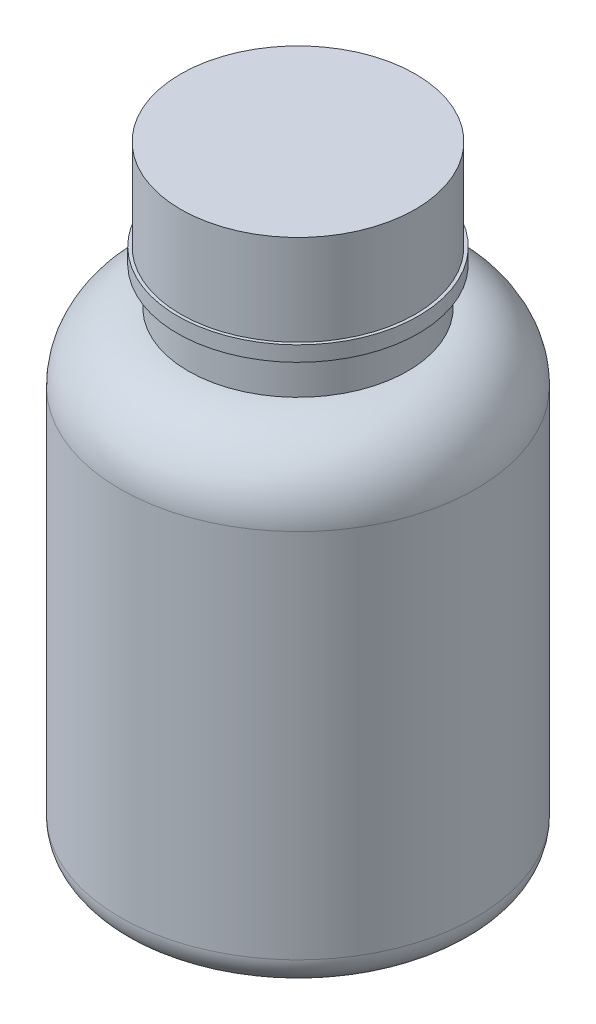
from build123d import *


with BuildPart() as part:
    # 草图1 → 旋转1 (revolve)
    with BuildSketch(Plane.XY):
        with BuildLine():
            Line((0, 56), (0, -25))
            Line((0, -25), (19.5, -25))
            ThreePointArc((19.5, -25), (22.328427125, -23.828427125), (23.5, -21))
            Line((23.5, -21), (23.5, 25))
            Line((23.5, 25), (23.5, 28))
            ThreePointArc((23.5, 28), (20.863961031, 34.363961031), (14.5, 37))
            Line((14.5, 37), (14.5, 42))
            Line((14.5, 42), (15.90903206, 42))
            Line((15.90903206, 42), (15.90903206, 44))
            Line((15.90903206, 44), (15.5, 44))
            Line((15.5, 44), (15.5, 56))
            Line((15.5, 56), (0, 56))
        make_face()
    revolve(axis=Axis((0, 0, 0), (0, 1, 0)))


solid = part.part
